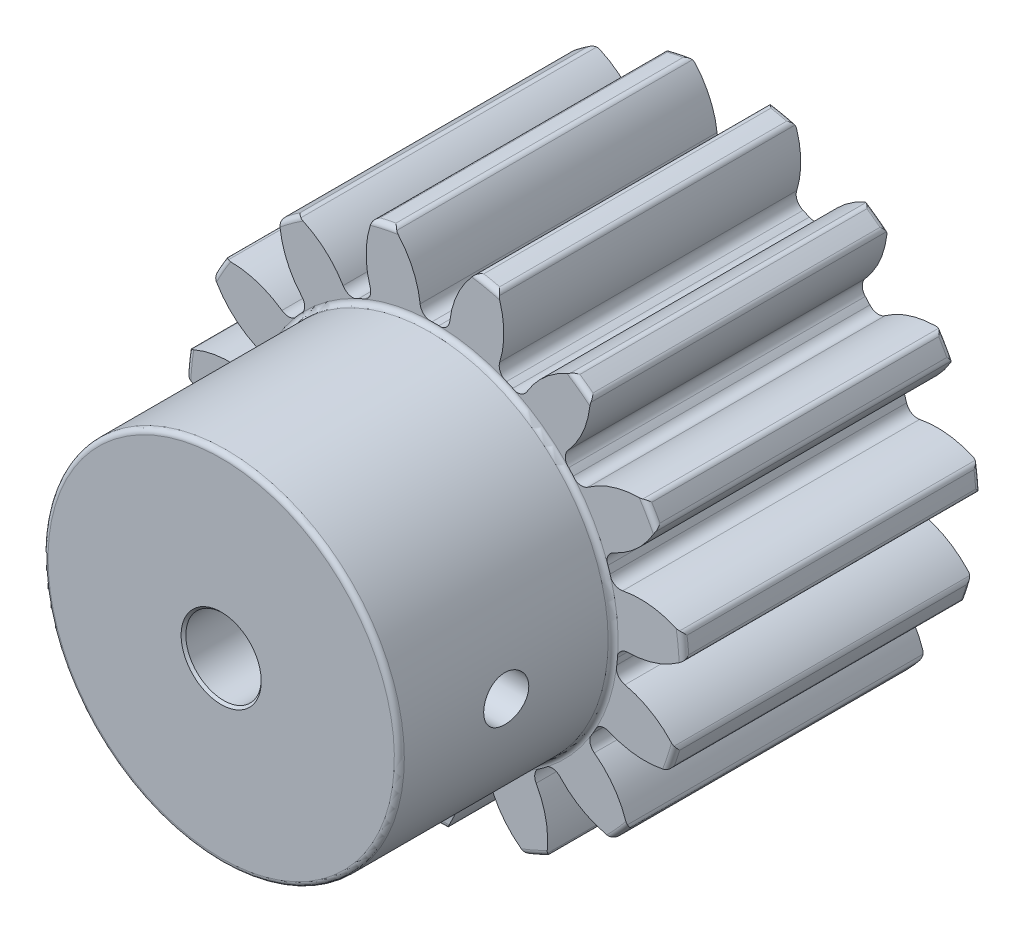
from build123d import *

# Parameters (mm, degrees)
FILLET2_R          = 0.420000001
CUT_EXTRUDE2_DEPTH = 39.820097928
FILLET3_R          = 0.950000005
FILLET4_R          = 0.475000002
CIRPATTERN1_DEPTH  = 25
CHAMFER1_SIZE      = 0.2
SKETCH8_R          = 1.89865
CUT_EXTRUDE3_DEPTH = 53.237462796
CIRPATTERN2_COUNT  = 2
CIRPATTERN2_ANGLE  = 90


# Read off the part's stored shape, not the designer's step: CirPattern1
with BuildPart() as part:
    # Sketch4 → Revolve1 (revolve)
    with BuildSketch(Plane(origin=(0, 0, 0), x_dir=(0, 0, -1), z_dir=(1, 0, 0))):
        Polygon((-43, 3.175), (-43, 15), (-25, 15), (-25, 21.000000037), (0, 21.000000037), (0, 3.175), align=None)
    revolve(axis=Axis((0, 0, 25), (0, 0, 1)))

    # Fillet2
    fillet2_edges = [part.edges().sort_by_distance(p)[0] for p in [
        (0, -21.000000037, 0),
        (0, -21.000000037, 25),
        (0, -15, 25),
        (0, -15, 43),
    ]]
    fillet(fillet2_edges, radius=FILLET2_R)

    # Sketch7 → Cut-Extrude2 (cut, through all)
    with BuildSketch(Plane.XY.offset(25)):
        with BuildLine():
            ThreePointArc((-3.449948087, 20.714677399), (0, 21.000000037), (3.449948087, 20.714677399))
            ThreePointArc((3.449948087, 20.714677399), (1.779877407, 18.249132947), (1.200928726, 15.328026318))
            ThreePointArc((1.200928726, 15.328026318), (0, 15.374999857), (-1.200928726, 15.328026318))
            ThreePointArc((-1.200928726, 15.328026318), (-1.779877407, 18.249132947), (-3.449948087, 20.714677399))
        make_face()
    extrude(amount=-CUT_EXTRUDE2_DEPTH, mode=Mode.SUBTRACT)

    # Fillet3
    # the kernel refuses this fillet: 0.950000005 mm, written as the material it adds along each edge
    with BuildSketch(Plane(origin=(-1.200928726, 15.328026318, 25), x_dir=(-0.054958232277186145, 0.9984886542695248, 0), z_dir=(0, 0, -1))) as fillet3_piece_1:
        with BuildLine():
            CenterArc((0.943414704, 0.948336754), FILLET3_R, 182.076875882, 84.532199447)
            ThreePointArc((-0.005961248, 0.913908388), (0.003811497, 0.456998498), (0, 0))
            ThreePointArc((0, 0), (0.443611929, 0.013130931), (0.887223859, 0))
        make_face()
    extrude(amount=25)
    with BuildSketch(Plane(origin=(1.200928726, 15.328026318, 25), x_dir=(-0.9988258879019196, 0.04844425308477533, 0), z_dir=(0, 0, -1))) as fillet3_piece_2:
        with BuildLine():
            CenterArc((0.942162999, 0.94958032), FILLET3_R, 183.764648673, 84.532199447)
            ThreePointArc((-0.005787067, 0.887204985), (0.010237118, 0.443688141), (0, 0))
            ThreePointArc((0, 0), (0.456963915, 0.006792265), (0.91392783, 0))
        make_face()
    extrude(amount=25)

    # Fillet4
    # the kernel refuses this fillet: 0.475000002 mm, written as the material it takes off along each edge
    with BuildSketch(Plane(origin=(3.449948087, 20.714677399, 25.221415354), x_dir=(0.9854131343583489, -0.17017918390348036, 0), z_dir=(0, 0, -1))) as fillet4_piece_1:
        with BuildLine():
            CenterArc((0.248324913, 0.474991509), FILLET4_R * 1.00000000105, 213.80485763, 56.537780641)
            ThreePointArc((-0.146370308, 0.210717626), (-0.07408627, 0.104732873), (0, 0))
            ThreePointArc((0, 0), (0.125582737, -0.000375504), (0.251165475, 0))
        make_face()
    extrude(amount=25.442830708, mode=Mode.SUBTRACT)
    with BuildSketch(Plane(origin=(-3.449948087, 20.714677399, 25.221415354), x_dir=(-0.98541313435835, -0.17017918390347403, 0), z_dir=(0, 0, -1))) as fillet4_piece_2:
        with BuildLine():
            CenterArc((0.248324913, -0.474991509), FILLET4_R * 1.00000000105, 89.657361729, 56.537780641)
            ThreePointArc((-0.146370308, -0.210717626), (-0.07408627, -0.104732873), (0, 0))
            ThreePointArc((0, 0), (0.125582737, 0.000375504), (0.251165475, 0))
        make_face()
    extrude(amount=25.442830708, mode=Mode.SUBTRACT)

    # CirPattern1 outline → CirPattern1 (cut)
    with BuildSketch(Plane.XY):
        with BuildLine():
            ThreePointArc((-5.030244638, 20.388639985), (-8.541469519, 19.184454645), (-11.785821658, 17.38086331))
            ThreePointArc((-11.785821658, 17.38086331), (-11.567833025, 17.460232391), (-11.338252889, 17.426893879))
            ThreePointArc((-11.338252889, 17.426893879), (-9.282604305, 16.159165675), (-7.736438722, 14.303848867))
            ThreePointArc((-7.736438722, 14.303848867), (-7.199043578, 13.879050307), (-6.5156467, 13.926125401))
            ThreePointArc((-6.5156467, 13.926125401), (-6.253575829, 14.045761281), (-5.989309403, 14.160465864))
            ThreePointArc((-5.989309403, 14.160465864), (-5.497044024, 14.636829331), (-5.453143337, 15.320437469))
            ThreePointArc((-5.453143337, 15.320437469), (-5.797325709, 17.710911682), (-5.363933799, 20.08683254))
            ThreePointArc((-5.363933799, 20.08683254), (-5.235090227, 20.279751142), (-5.030244638, 20.388639985))
        make_face()
        with BuildLine():
            ThreePointArc((-12.888164125, 16.579964628), (-15.606041363, 14.051742758), (-17.836317837, 11.084483189))
            ThreePointArc((-17.836317837, 11.084483189), (-17.669457625, 11.245654418), (-17.44616574, 11.308576825))
            ThreePointArc((-17.44616574, 11.308576825), (-15.052605799, 10.986557088), (-12.885487924, 9.920523045))
            ThreePointArc((-12.885487924, 9.920523045), (-12.221771891, 9.751028546), (-11.616604943, 10.071996336))
            ThreePointArc((-11.616604943, 10.071996336), (-11.425851585, 10.287882977), (-11.23108675, 10.500157667))
            ThreePointArc((-11.23108675, 10.500157667), (-10.975134426, 11.135559717), (-11.213077633, 11.777922844))
            ThreePointArc((-11.213077633, 11.777922844), (-12.499797331, 13.821738121), (-13.070248194, 16.168526198))
            ThreePointArc((-13.070248194, 16.168526198), (-13.031010799, 16.397171512), (-12.888164125, 16.579964628))
        make_face()
        with BuildLine():
            ThreePointArc((-18.517602948, 9.904462762), (-19.972186878, 6.489356893), (-20.802752624, 2.871495226))
            ThreePointArc((-20.802752624, 2.871495226), (-20.71587248, 3.086600633), (-20.537478041, 3.234904104))
            ThreePointArc((-20.537478041, 3.234904104), (-18.219875003, 3.914272971), (-15.806519203, 3.821848662))
            ThreePointArc((-15.806519203, 3.821848662), (-15.131244813, 3.936965364), (-14.708946658, 4.476327604))
            ThreePointArc((-14.708946658, 4.476327604), (-14.622493802, 4.751136244), (-14.530907166, 5.024276818))
            ThreePointArc((-14.530907166, 5.024276818), (-14.55552438, 5.708850663), (-15.034168937, 6.19889836))
            ThreePointArc((-15.034168937, 6.19889836), (-17.040940438, 7.542660471), (-18.516597938, 9.45453479))
            ThreePointArc((-18.516597938, 9.45453479), (-18.573751221, 9.679371965), (-18.517602948, 9.904462762))
        make_face()
        with BuildLine():
            ThreePointArc((-20.945179995, 1.516389306), (-20.88495984, -2.195097732), (-20.172202495, -5.838000348))
            ThreePointArc((-20.172202495, -5.838000348), (-20.180324785, -5.606154443), (-20.077673811, -5.398112926))
            ThreePointArc((-20.077673811, -5.398112926), (-18.236762296, -3.834824503), (-15.994459714, -2.937658074))
            ThreePointArc((-15.994459714, -2.937658074), (-15.424388043, -2.557834895), (-15.257977869, -1.893338837))
            ThreePointArc((-15.257977869, -1.893338837), (-15.290773999, -1.607125108), (-15.318201724, -1.320347136))
            ThreePointArc((-15.318201724, -1.320347136), (-15.619131935, -0.704970532), (-16.255715852, -0.451971966))
            ThreePointArc((-16.255715852, -0.451971966), (-18.635550131, -0.040611697), (-20.761259679, 1.105768426))
            ThreePointArc((-20.761259679, 1.105768426), (-20.904921319, 1.287921071), (-20.945179995, 1.516389306))
        make_face()
        with BuildLine():
            ThreePointArc((-19.75114514, -7.133881638), (-18.186533512, -10.500000019), (-16.053695296, -13.538052626))
            ThreePointArc((-16.053695296, -13.538052626), (-16.155415602, -13.329554485), (-16.14625738, -13.09774719))
            ThreePointArc((-16.14625738, -13.09774719), (-15.100347712, -10.920845983), (-13.416812836, -9.189217042))
            ThreePointArc((-13.416812836, -9.189217042), (-13.050514455, -8.610362264), (-13.168766092, -7.935629793))
            ThreePointArc((-13.168766092, -7.935629793), (-13.315140459, -7.687499928), (-13.456840042, -7.436671076))
            ThreePointArc((-13.456840042, -7.436671076), (-13.982049684, -6.996895918), (-14.666501817, -7.024692233))
            ThreePointArc((-14.666501817, -7.024692233), (-17.007903908, -7.616861733), (-19.416111012, -7.434195346))
            ThreePointArc((-19.416111012, -7.434195346), (-19.621440607, -7.326223077), (-19.75114514, -7.133881638))
        make_face()
        with BuildLine():
            ThreePointArc((-15.141957856, -14.550639637), (-12.34349032, -16.989356912), (-9.159358337, -18.897252615))
            ThreePointArc((-9.159358337, -18.897252615), (-9.337088294, -18.748153462), (-9.423006364, -18.532661976))
            ThreePointArc((-9.423006364, -18.532661976), (-9.352945827, -16.118553979), (-8.51927713, -13.851876901))
            ThreePointArc((-8.51927713, -13.851876901), (-8.420088357, -13.174079775), (-8.802555023, -12.605778265))
            ThreePointArc((-8.802555023, -12.605778265), (-9.03719817, -12.438636173), (-9.268668466, -12.267127026))
            ThreePointArc((-9.268668466, -12.267127026), (-9.92734402, -12.078994436), (-10.541316377, -12.382779395))
            ThreePointArc((-10.541316377, -12.382779395), (-12.439436587, -13.876087179), (-14.713740362, -14.688719204))
            ThreePointArc((-14.713740362, -14.688719204), (-14.945234558, -14.673596699), (-15.141957856, -14.550639637))
        make_face()
        with BuildLine():
            ThreePointArc((-7.914588499, -19.451459854), (-4.366145515, -20.541099652), (-0.681285111, -20.988945951))
            ThreePointArc((-0.681285111, -20.988945951), (-0.904293596, -20.925026383), (-1.070431942, -20.763111142))
            ThreePointArc((-1.070431942, -20.763111142), (-1.988334639, -18.52921756), (-2.148681014, -16.119421405))
            ThreePointArc((-2.148681014, -16.119421405), (-2.333752488, -15.45987921), (-2.914302222, -15.096273155))
            ThreePointArc((-2.914302222, -15.096273155), (-3.196642216, -15.039019221), (-3.477859908, -14.976485271))
            ThreePointArc((-3.477859908, -14.976485271), (-4.156110387, -15.072525081), (-4.59344157, -15.599771506))
            ThreePointArc((-4.59344157, -15.599771506), (-5.720077671, -17.736011091), (-7.467230332, -19.403430069))
            ThreePointArc((-7.467230332, -19.403430069), (-7.684861681, -19.483772145), (-7.914588499, -19.451459854))
        make_face()
        with BuildLine():
            ThreePointArc((0.681285111, -20.988945951), (4.366145515, -20.541099652), (7.914588499, -19.451459854))
            ThreePointArc((7.914588499, -19.451459854), (7.684861681, -19.483772145), (7.467229888, -19.403429765))
            ThreePointArc((7.467229888, -19.403429765), (5.720077671, -17.736011091), (4.59344157, -15.599771506))
            ThreePointArc((4.59344157, -15.599771506), (4.156110387, -15.072525081), (3.477859908, -14.976485271))
            ThreePointArc((3.477859908, -14.976485271), (3.196642216, -15.039019221), (2.914302222, -15.096273155))
            ThreePointArc((2.914302222, -15.096273155), (2.333752488, -15.45987921), (2.148681014, -16.119421405))
            ThreePointArc((2.148681014, -16.119421405), (1.988334639, -18.52921756), (1.070431659, -20.763111601))
            ThreePointArc((1.070431659, -20.763111601), (0.904293596, -20.925026383), (0.681285111, -20.988945951))
        make_face()
        with BuildLine():
            ThreePointArc((9.159358337, -18.897252615), (12.34349032, -16.989356912), (15.141957856, -14.550639637))
            ThreePointArc((15.141957856, -14.550639637), (14.945234558, -14.673596699), (14.713739832, -14.688719107))
            ThreePointArc((14.713739832, -14.688719107), (12.439436587, -13.876087179), (10.541316377, -12.382779395))
            ThreePointArc((10.541316377, -12.382779395), (9.92734402, -12.078994436), (9.268668466, -12.267127026))
            ThreePointArc((9.268668466, -12.267127026), (9.03719817, -12.438636173), (8.802555023, -12.605778265))
            ThreePointArc((8.802555023, -12.605778265), (8.420088357, -13.174079775), (8.51927713, -13.851876901))
            ThreePointArc((8.51927713, -13.851876901), (9.352945827, -16.118553979), (9.423006292, -18.53266251))
            ThreePointArc((9.423006292, -18.53266251), (9.337088294, -18.748153462), (9.159358337, -18.897252615))
        make_face()
        with BuildLine():
            ThreePointArc((16.053695296, -13.538052626), (18.186533512, -10.500000019), (19.75114514, -7.133881638))
            ThreePointArc((19.75114514, -7.133881638), (19.621440607, -7.326223077), (19.416110489, -7.434195472))
            ThreePointArc((19.416110489, -7.434195472), (17.007903908, -7.616861733), (14.666501817, -7.024692233))
            ThreePointArc((14.666501817, -7.024692233), (13.982049684, -6.996895918), (13.456840042, -7.436671076))
            ThreePointArc((13.456840042, -7.436671076), (13.315140459, -7.687499929), (13.168766092, -7.935629793))
            ThreePointArc((13.168766092, -7.935629793), (13.050514455, -8.610362264), (13.416812836, -9.189217042))
            ThreePointArc((13.416812836, -9.189217042), (15.100347712, -10.920845983), (16.146257532, -13.097747707))
            ThreePointArc((16.146257532, -13.097747707), (16.155415602, -13.329554485), (16.053695296, -13.538052626))
        make_face()
        with BuildLine():
            ThreePointArc((20.172202495, -5.838000348), (20.88495984, -2.195097732), (20.945179995, 1.516389306))
            ThreePointArc((20.945179995, 1.516389306), (20.904921319, 1.287921071), (20.761259253, 1.105768097))
            ThreePointArc((20.761259253, 1.105768097), (18.635550131, -0.040611697), (16.255715852, -0.451971966))
            ThreePointArc((16.255715852, -0.451971966), (15.619131935, -0.704970532), (15.318201724, -1.320347136))
            ThreePointArc((15.318201724, -1.320347136), (15.290773999, -1.607125108), (15.257977869, -1.893338837))
            ThreePointArc((15.257977869, -1.893338837), (15.424388043, -2.557834895), (15.994459714, -2.937658074))
            ThreePointArc((15.994459714, -2.937658074), (18.236762296, -3.834824503), (20.077674161, -5.398113336))
            ThreePointArc((20.077674161, -5.398113336), (20.180324785, -5.606154443), (20.172202495, -5.838000348))
        make_face()
        with BuildLine():
            ThreePointArc((20.802752624, 2.871495226), (19.972186878, 6.489356893), (18.517602948, 9.904462762))
            ThreePointArc((18.517602948, 9.904462762), (18.573751221, 9.679371965), (18.516597681, 9.454534316))
            ThreePointArc((18.516597681, 9.454534316), (17.040940438, 7.542660471), (15.034168937, 6.19889836))
            ThreePointArc((15.034168937, 6.19889836), (14.55552438, 5.708850663), (14.530907166, 5.024276818))
            ThreePointArc((14.530907166, 5.024276818), (14.622493802, 4.751136244), (14.708946658, 4.476327604))
            ThreePointArc((14.708946658, 4.476327604), (15.131244813, 3.936965364), (15.806519203, 3.821848662))
            ThreePointArc((15.806519203, 3.821848662), (18.219875003, 3.914272971), (20.537478527, 3.234903871))
            ThreePointArc((20.537478527, 3.234903871), (20.71587248, 3.086600633), (20.802752624, 2.871495226))
        make_face()
        with BuildLine():
            ThreePointArc((17.836317837, 11.084483189), (15.606041363, 14.051742758), (12.888164125, 16.579964628))
            ThreePointArc((12.888164125, 16.579964628), (13.031010799, 16.397171512), (13.070248153, 16.168525661))
            ThreePointArc((13.070248153, 16.168525661), (12.499797331, 13.821738121), (11.213077633, 11.777922844))
            ThreePointArc((11.213077633, 11.777922844), (10.975134426, 11.135559717), (11.23108675, 10.500157667))
            ThreePointArc((11.23108675, 10.500157667), (11.425851585, 10.287882977), (11.616604943, 10.071996336))
            ThreePointArc((11.616604943, 10.071996336), (12.221771891, 9.751028546), (12.885487924, 9.920523045))
            ThreePointArc((12.885487924, 9.920523045), (15.052605799, 10.986557088), (17.446166278, 11.30857681))
            ThreePointArc((17.446166278, 11.30857681), (17.669457625, 11.245654418), (17.836317837, 11.084483189))
        make_face()
        with BuildLine():
            ThreePointArc((5.989309403, 14.160465864), (6.253575829, 14.045761281), (6.5156467, 13.926125401))
            ThreePointArc((6.5156467, 13.926125401), (7.199043578, 13.879050307), (7.736438722, 14.303848867))
            ThreePointArc((7.736438722, 14.303848867), (9.282604305, 16.159165675), (11.338253387, 17.426894084))
            ThreePointArc((11.338253387, 17.426894084), (11.567833025, 17.460232391), (11.785821658, 17.38086331))
            ThreePointArc((11.785821658, 17.38086331), (8.541469519, 19.184454645), (5.030244638, 20.388639985))
            ThreePointArc((5.030244638, 20.388639985), (5.235090227, 20.279751142), (5.36393398, 20.086832032))
            ThreePointArc((5.36393398, 20.086832032), (5.797325709, 17.710911682), (5.453143337, 15.320437469))
            ThreePointArc((5.453143337, 15.320437469), (5.497044024, 14.636829331), (5.989309403, 14.160465864))
        make_face()
    extrude(amount=CIRPATTERN1_DEPTH, mode=Mode.SUBTRACT)

    # Chamfer1
    chamfer1_edges = [part.edges().sort_by_distance(p)[0] for p in [
        (0, -3.175, 0),
        (0, -3.175, 43),
    ]]
    chamfer(chamfer1_edges, length=CHAMFER1_SIZE)

    # Sketch8 → Cut-Extrude3 (cut, through all)
    with BuildSketch(Plane(origin=(0, 0, 0), x_dir=(1, 0, 0), z_dir=(0, 1, 0))):
        with Locations(Location((0, -34, 0), (0, 0, 270))):
            Circle(SKETCH8_R)
    cut_extrude3 = extrude(amount=-CUT_EXTRUDE3_DEPTH, mode=Mode.SUBTRACT)

    # CirPattern2: Cut-Extrude3 ×2 about axis
    cirpattern2_axis = Axis((0, 0, 0), (0, 0, 1))
    for i in range(1, CIRPATTERN2_COUNT):
        add(cut_extrude3.rotate(cirpattern2_axis, i * CIRPATTERN2_ANGLE / (CIRPATTERN2_COUNT - 1)), mode=Mode.SUBTRACT)


solid = part.part
